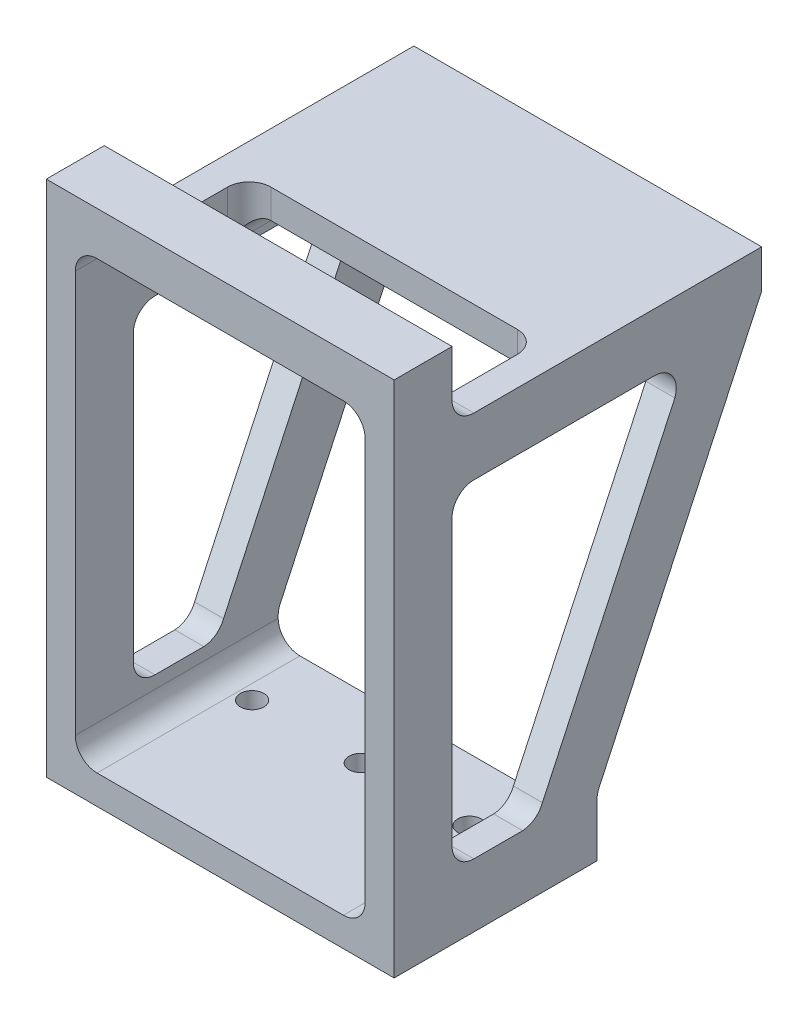
from build123d import *

# Parameters (mm, degrees)
BOSS_EXTRUDE1_DEPTH             = 179.04999999999998
BOSS_EXTRUDE1_DEPTH_BACK        = 139.19200000000004
BOSS_EXTRUDE2_REACH             = 246.692
BOSS_EXTRUDE2_DIRECTION_2_REACH = 246.692
F_3_8_CLEARANCE_HOLE1_D         = 10.31748
CUT_EXTRUDE1_DEPTH              = 245.69215738419686
CUT_EXTRUDE1_DEPTH_BACK         = 245.69215738419686
FILLET1_R                       = 9.525
CUT_EXTRUDE2_DEPTH              = 101.6
CUT_EXTRUDE2_DEPTH_BACK         = 184.22
FILLET2_START                   = -36
FILLET2_DEPTH                   = 185.025000106
FILLET2_START_2                 = -63.5
FILLET2_2_DEPTH                 = 9.525
FILLET2_START_3                 = 53.975
FILLET2_3_DEPTH                 = 9.525
FILLET2_START_4                 = 149.025000106
FILLET2_4_DEPTH                 = 9.525
FILLET2_5_DEPTH                 = 185.025000106
CUT_EXTRUDE3_DEPTH              = 245.69215738419686
CUT_EXTRUDE3_DEPTH_BACK         = 245.69215738419686
FILLET3_R                       = 9.525
CUT_EXTRUDE4_REACH              = 254.594
CUT_EXTRUDE5_DEPTH              = 245.6921573841969
CUT_EXTRUDE5_DEPTH_BACK         = 25.4
FILLET5_R                       = 9.525
CUT_EXTRUDE6_DEPTH              = 245.6921574759669
CUT_EXTRUDE6_DEPTH_BACK         = 245.6921574759669


with BuildPart() as part:
    # Sketch1 → Boss-Extrude1 (new, two sides: drawn at the far end of the back side and taken through both)
    with BuildSketch(Plane(origin=(0, 0, 0), x_dir=(1, 0, 0), z_dir=(0, 1, 0)).offset(-BOSS_EXTRUDE1_DEPTH_BACK)):
        Polygon((-76.20000000000003, 148.35400023367268), (-76.2000000000001, -12.7), (76.2, -12.7), (76.19999999999997, 148.35400023367268), align=None)
    extrude(amount=BOSS_EXTRUDE1_DEPTH + BOSS_EXTRUDE1_DEPTH_BACK)

    # SurfaceCut1
    split(bisect_by=Plane(origin=(-4.831e-14, -47.89499999999913, 0), x_dir=(1, -6e-17, 0), z_dir=(6e-17, 1, -1.73e-15)), keep=Keep.TOP)

    # Boss-Extrude2: up to this face of the body (flat: up to its plane)
    boss_extrude2_end = Plane(part.part.faces().sort_by_distance((76.2, 65.5775, -67.827000117))[0])
    # Sketch3 → Boss-Extrude2 (add, up to the picked face)
    with BuildSketch(Plane(origin=(0, 0, 0), x_dir=(0, 0, -1), z_dir=(1, 0, 0)), mode=Mode.PRIVATE) as boss_extrude2_sk1:
        Polygon((1.2e-16, -38.36999999999911), (75, -38.36999999999911), (75, -47.89499999999911), (1.29e-15, -47.89499999999911), align=None)
    boss_extrude2_tool1 = split(extrude(boss_extrude2_sk1.sketch, amount=BOSS_EXTRUDE2_REACH, mode=Mode.PRIVATE), bisect_by=boss_extrude2_end, keep=Keep.BOTH, mode=Mode.PRIVATE)
    add(boss_extrude2_tool1.solids().sort_by(Axis((0, -43.1325, -37.5), (1, 0, 0)))[0])

    # Boss-Extrude2 direction 2: up to this face of the body (flat: up to its plane)
    boss_extrude2_direction_2_end = Plane(part.part.faces().sort_by_distance((-76.2, 65.5775, -67.827000117))[0])
    # Sketch3 → Boss-Extrude2 direction 2 (add, up to the picked face)
    with BuildSketch(Plane(origin=(0, 0, 0), x_dir=(0, 0, -1), z_dir=(1, 0, 0)), mode=Mode.PRIVATE) as boss_extrude2_direction_2_sk1:
        Polygon((1.2e-16, -38.36999999999911), (75, -38.36999999999911), (75, -47.89499999999911), (1.29e-15, -47.89499999999911), align=None)
    boss_extrude2_direction_2_tool1 = split(extrude(boss_extrude2_direction_2_sk1.sketch, amount=-BOSS_EXTRUDE2_DIRECTION_2_REACH, mode=Mode.PRIVATE), bisect_by=boss_extrude2_direction_2_end, keep=Keep.BOTH, mode=Mode.PRIVATE)
    add(boss_extrude2_direction_2_tool1.solids().sort_by(Axis((0, -43.1325, -37.5), (-1, 0, 0)))[0])

    # 3/8 Clearance Hole1 (through all)
    with Locations(Plane.XZ.offset(47.89499999999913)):
        with Locations((47.625, -48.895), (-47.625, -48.895), (0, -48.895)):
            Hole(F_3_8_CLEARANCE_HOLE1_D / 2)

    # Sketch8 → Cut-Extrude1 (cut, two sides: drawn at the far end of the back side and taken through both)
    with BuildSketch(Plane(origin=(0, 0, 0), x_dir=(0, 0, -1), z_dir=(1, 0, 0)).offset(-CUT_EXTRUDE1_DEPTH_BACK)):
        Polygon((266.69999999999993, 301.4250001060008), (12.699999999999932, 301.42500010600077), (12.699999999999935, 149.02500010600082), (266.69999999999993, 149.02500010600085), align=None)
    extrude(amount=CUT_EXTRUDE1_DEPTH + CUT_EXTRUDE1_DEPTH_BACK, mode=Mode.SUBTRACT)

    # Fillet1
    fillet1_edges = [part.edges().sort_by_distance(p)[0] for p in [
        (-2.842e-14, 149.02500010600082, -12.699999999999935),
    ]]
    fillet(fillet1_edges, radius=FILLET1_R)

    # Sketch10 → Cut-Extrude2 (cut, two sides: drawn at the far end of the back side and taken through both)
    with BuildSketch(Plane(origin=(0, 149.02500010600082, 1.628e-14), x_dir=(1, 0, 0), z_dir=(0, 1, 1.1e-16)).offset(-CUT_EXTRUDE2_DEPTH_BACK)):
        Polygon((63.500000000000014, 63.49999999999994), (-63.500000000000014, 63.49999999999993), (-63.5, 12.699999999999932), (63.5, 12.699999999999948), align=None)
    extrude(amount=CUT_EXTRUDE2_DEPTH + CUT_EXTRUDE2_DEPTH_BACK, mode=Mode.SUBTRACT)

    # Fillet2: read off the stored shape, not the designer's step
    # Fillet2 outline → Fillet2 (add)
    with BuildSketch(Plane(origin=(0, 0, 0), x_dir=(1, 0, 0), z_dir=(0, 1, 0)).offset(FILLET2_START)):
        with BuildLine():
            Line((-63.5, 12.7), (-53.975, 12.7))
            ThreePointArc((-53.975, 12.7), (-60.710192091, 15.489807909), (-63.5, 22.225))
            Line((-63.5, 22.225), (-63.5, 12.7))
        make_face()
        with BuildLine():
            ThreePointArc((63.5, 22.225), (60.710192091, 15.489807909), (53.975, 12.7))
            Line((53.975, 12.7), (63.5, 12.7))
            Line((63.5, 12.7), (63.5, 22.225))
        make_face()
    extrude(amount=FILLET2_DEPTH)

    # Fillet2 2 outline → Fillet2 2 (add)
    with BuildSketch(Plane.YZ.offset(FILLET2_START_2)):
        with BuildLine():
            Line((149.025000106, -12.7), (149.025000106, -22.225))
            ThreePointArc((149.025000106, -22.225), (151.814808015, -15.489807909), (158.550000106, -12.7))
            Line((158.550000106, -12.7), (149.025000106, -12.7))
        make_face()
    extrude(amount=FILLET2_2_DEPTH)

    # Fillet2 3 outline → Fillet2 3 (add)
    with BuildSketch(Plane.YZ.offset(FILLET2_START_3)):
        with BuildLine():
            Line((149.025000106, -12.7), (149.025000106, -22.225))
            ThreePointArc((149.025000106, -22.225), (151.814808015, -15.489807909), (158.550000106, -12.7))
            Line((158.550000106, -12.7), (149.025000106, -12.7))
        make_face()
    extrude(amount=FILLET2_3_DEPTH)

    # Fillet2 4 outline → Fillet2 4 (cut)
    with BuildSketch(Plane(origin=(0, 0, 0), x_dir=(1, 0, 0), z_dir=(0, 1, 0)).offset(FILLET2_START_4)):
        with BuildLine():
            Line((-53.975, 22.225), (-63.5, 22.225))
            ThreePointArc((-63.5, 22.225), (-60.710192091, 15.489807909), (-53.975, 12.7))
            Line((-53.975, 12.7), (-53.975, 22.225))
        make_face()
        with BuildLine():
            ThreePointArc((53.975, 12.7), (60.710192091, 15.489807909), (63.5, 22.225))
            Line((63.5, 22.225), (53.975, 22.225))
            Line((53.975, 22.225), (53.975, 12.7))
        make_face()
    extrude(amount=FILLET2_4_DEPTH, mode=Mode.SUBTRACT)

    # Fillet2 5 outline → Fillet2 5 (add)
    with BuildSketch(Plane(origin=(0, 0, 0), x_dir=(1, 0, 0), z_dir=(0, 1, 0)).offset(FILLET2_START)):
        with BuildLine():
            ThreePointArc((53.975, 63.5), (60.710192091, 60.710192091), (63.5, 53.975))
            Line((63.5, 53.975), (63.5, 22.225))
            Line((63.5, 22.225), (76.2, 22.225))
            Line((76.2, 22.225), (76.2, 148.354000234))
            Line((76.2, 148.354000234), (-76.2, 148.354000234))
            Line((-76.2, 148.354000234), (-76.2, 22.225))
            Line((-76.2, 22.225), (-63.5, 22.225))
            Line((-63.5, 22.225), (-63.5, 53.975))
            ThreePointArc((-63.5, 53.975), (-60.710192091, 60.710192091), (-53.975, 63.5))
            Line((-53.975, 63.5), (53.975, 63.5))
        make_face()
    extrude(amount=FILLET2_5_DEPTH)

    # Sketch11 → Cut-Extrude3 (cut, two sides: drawn at the far end of the back side and taken through both)
    with BuildSketch(Plane(origin=(0, 0, 0), x_dir=(0, 0, -1), z_dir=(1, 0, 0)).offset(-CUT_EXTRUDE3_DEPTH_BACK)):
        Polygon((279.3999999999999, 413.26880624754574), (76.19999999999999, -22.494999999999397), (76.19999999999999, -78.83303235544759), (279.3999999999999, -78.83303235544756), align=None)
    extrude(amount=CUT_EXTRUDE3_DEPTH + CUT_EXTRUDE3_DEPTH_BACK, mode=Mode.SUBTRACT)

    # Fillet3
    fillet3_edges = [part.edges().sort_by_distance(p)[0] for p in [
        (-5.684e-14, -22.494999999999397, -76.19999999999999),
    ]]
    fillet(fillet3_edges, radius=FILLET3_R)

    # Cut-Extrude4: up to this face of the body (flat: up to its plane)
    cut_extrude4_end = Plane(part.part.faces().sort_by_distance((0, 75.599563928, -12.7))[0])
    # Sketch14 → Cut-Extrude4 (cut, up to the picked face)
    with BuildSketch(Plane(origin=(0, 0, -148.35400023367268), x_dir=(-1, 0, 0), z_dir=(0, 0, -1)), mode=Mode.PRIVATE) as cut_extrude4_sk1:
        Polygon((-63.5, 136.32500010600086), (63.5, 136.32500010600089), (63.50000000000004, -35.19499999999937), (-63.499999999999986, -35.19499999999938), align=None)
    cut_extrude4_tool1 = split(extrude(cut_extrude4_sk1.sketch, amount=-CUT_EXTRUDE4_REACH, mode=Mode.PRIVATE), bisect_by=cut_extrude4_end, keep=Keep.BOTH, mode=Mode.PRIVATE)
    add(cut_extrude4_tool1.solids().sort_by(Axis((0, 50.565, -148.354), (0, 0, 1)))[0], mode=Mode.SUBTRACT)

    # Sketch15 → Cut-Extrude5 (cut, two sides: drawn at the far end of the back side and taken through both)
    with BuildSketch(Plane.XY.offset(-CUT_EXTRUDE5_DEPTH_BACK)):
        Polygon((63.5, 159.99999999999997), (-63.5, 159.99999999999994), (-63.500000000000014, -35.194999999999425), (63.50000000000007, -35.19499999999941), align=None)
    extrude(amount=CUT_EXTRUDE5_DEPTH + CUT_EXTRUDE5_DEPTH_BACK, mode=Mode.SUBTRACT)

    # Fillet5
    fillet5_edges = [part.edges().sort_by_distance(p)[0] for p in [
        (63.5, 159.99999999999997, 2.842e-14),
        (-63.5, 159.99999999999994, 2.842e-14),
        (-63.5, 136.32500010600089, -101.16450011683634),
        (63.5, 136.32500010600086, -101.16450011683634),
        (63.5, -35.19499989399918, -38.1),
        (-63.5, -35.19499989399918, -38.1),
    ]]
    fillet(fillet5_edges, radius=FILLET5_R)

    # Sketch16 → Cut-Extrude6 (cut, two sides: drawn at the far end of the back side and taken through both)
    with BuildSketch(Plane(origin=(0, 0, 0), x_dir=(0, 0, -1), z_dir=(1, 0, 0)).offset(-CUT_EXTRUDE6_DEPTH_BACK)):
        with BuildLine():
            Line((22.225, -20.152543088136632), (43.61046140315716, -20.152543088136635))
            ThreePointArc((43.61046140315716, -20.152543088136635), (48.871667611787636, -18.266432044059904), (52.27951237608929, -13.836499798218902))
            Line((52.27951237608929, -13.836499798218902), (110.28947349119366, 110.6974636611936))
            ThreePointArc((110.28947349119366, 110.6974636611936), (109.2394256542931, 119.49983646292918), (101.39293648279772, 123.62500010600078))
            Line((101.39293648279772, 123.62500010600078), (22.225000000000072, 123.6250001060008))
            ThreePointArc((22.225000000000072, 123.6250001060008), (15.489807909198145, 120.83519219680267), (12.700000000000001, 114.10000010600075))
            Line((12.700000000000001, 114.10000010600075), (12.7, -10.627543088136633))
            ThreePointArc((12.7, -10.627543088136633), (15.489807909198138, -17.362735178938497), (22.225, -20.152543088136632))
        make_face()
    extrude(amount=CUT_EXTRUDE6_DEPTH + CUT_EXTRUDE6_DEPTH_BACK, mode=Mode.SUBTRACT)


solid = part.part
